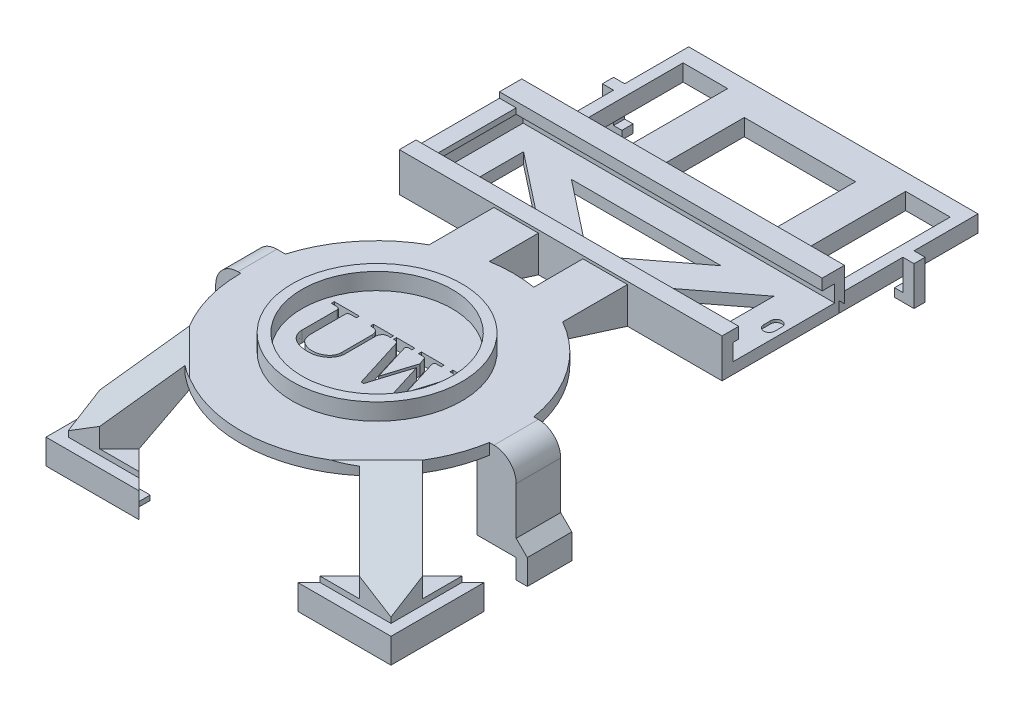
from build123d import *

# Parameters (mm, degrees)
NEOPIXEL_CIRCLE_R                              = 23.5
NEOPIXEL_CIRCLE_R_2                            = 14.5
NEOPIXLE_BASE_DEPTH                            = 2
NEOPIXEL_CIRCLE_R_3                            = 13.5
NEOPIXLE_BASE_2_DEPTH                          = 2
SKETCH2_5_R                                    = 24.5
SKETCH2_5_R_2                                  = 23.5
SKETCH2_5_R_3                                  = 14.5
SKETCH2_5_R_4                                  = 13.5
NEOPIXEL_WALLS_DEPTH                           = 5
BOTTOM_2_SUPPORTS_DEPTH                        = 13.5
BOTTOM_2_SUPPORTS_2_DEPTH                      = 13.5
REMOVING_START                                 = 2
NEOPIXEL_CIRCLE_7_R                            = 24.5
NEOPIXEL_CIRCLE_7_R_2                          = 23.5
REMOVING_NEOPIXEL_OUTER_WALL_DEPTH             = 5
LEVELING_BOTOM_SUPPORTS_DEPTH                  = 2
BOTTOM_RIGHT_SUPPORT_CUT_1_DEPTH               = 48.02629633
BOTTOM_RIGHT_SUPPORT_CUT_1_DEPTH_BACK          = 48.02629633
BOTOM_LEFT_SUPPORT_CUT_1_DEPTH                 = 48.02629633
BOTOM_LEFT_SUPPORT_CUT_1_DEPTH_BACK            = 48.02629633
BOTTOM_SUPPORTS_SMALL_CUTS_DEPTH               = 13.5
MICROBIT_AND_CASE_SUPPORTS_10_W                = 8.093983266
MICROBIT_AND_CASE_SUPPORTS_10_H                = 7
MICROBIT_AND_CASE_SUPPORTS_10_W_2              = 7
MICROBIT_AND_CASE_SUPPORTS_10_H_2              = 8
SIDE_SUPPORTS_1_DEPTH                          = 13.5
MICROBIT_AND_CASE_SUPPORTS_11_W                = 8.093983266
MICROBIT_AND_CASE_SUPPORTS_11_H                = 7
MICROBIT_AND_CASE_SUPPORTS_11_W_2              = 7
MICROBIT_AND_CASE_SUPPORTS_11_H_2              = 8
SIDE_SUPPORTS_2_DEPTH                          = 2
MICROBIT_AND_CASE_SUPPORTS_12_W                = 8
MICROBIT_AND_CASE_SUPPORTS_12_H                = 14.279211733
TOP_SUPPORTS_1_DEPTH                           = 2
MICROBIT_AND_CASE_SUPPORTS_13_W                = 8
MICROBIT_AND_CASE_SUPPORTS_13_H                = 14.279211733
SOMETHING_WITH_TOP_SUPPORTS_DEPTH              = 4.5
NAME_START                                     = -2.5
MICROBIT_AND_CASE_SUPPORTS_14_W                = 58
MICROBIT_AND_CASE_SUPPORTS_14_H                = 21
NAME_PLATE_BACK_DEPTH                          = 2
TOP_START                                      = -4.5
MICROBIT_AND_CASE_SUPPORTS_15_W                = 52
MICROBIT_AND_CASE_SUPPORTS_15_H                = 34
TOP_GANE_PLATE_DEPTH                           = 3
TOP_PLATE_CONNECTOR_W                          = 52
TOP_PLATE_CONNECTOR_H                          = 2
TOP_PLATE_CONNECTOR_PIECE_1_DEPTH              = 2
TOP_PLATE_CONNECTOR_PIECE_2_DEPTH              = 105.648220243
TOP_PLATE_CONNECTOR_PIECE_2_DEPTH_BACK         = 105.648220243
TOP_PLATE_HOLES_W                              = 20
TOP_PLATE_HOLES_H                              = 20
TOP_PLATE_HOLES_W_2                            = 7
TOP_PLATE_HOLES_H_2                            = 17
TOP_PLATE_CUTS_DEPTH                           = 94.141022112
OVERHANG_START                                 = -12.5
MICROBIT_AND_CASE_SUPPORTS_18_W                = 2
MICROBIT_AND_CASE_SUPPORTS_18_H                = 7
MICROBIT_AND_CASE_SUPPORTS_18_H_2              = 8
OVERHANG_ON_SUPPORTS_DEPTH                     = 4.5
BACK_SUPPORTS_W                                = 12.727922061
BACK_SUPPORTS_H                                = 1.85
BACK_SUPPORTS_PIECE_DEPTH                      = 2.5
CIRCLE_CUT_FOR_BACK_PLATE_DEPTH                = 4
MID_RIGHT_SUPPORT_EXTRA_1_DEPTH                = 8
MID_LEFT_SUPPORT_EXTRA_1_1_DEPTH               = 7
NAME_TAG_EXTRUSION_DEPTH                       = 4
NAME_PLATE_DETAILS_W                           = 17
NAME_PLATE_DETAILS_H                           = 2
NAME_PLATE_DETAILS_1_1_DEPTH                   = 56
SIDE_SUPPPORTS_DETAILS_R                       = 4
NAME_TAG_HOLDER_R                              = 1
NAMETAG_HOLDER_DEPTH                           = 0.5
DECORATIONS_DEPTH                              = 95.420601566
TOP_SUPPORTS_CT_1_DEPTH                        = 100.408249155
TOP_SUPPORTS_CT_1_DEPTH_BACK                   = 100.408249155
TOP_CUT_AWAY_FOR_BACK_PLATE_W                  = 52
TOP_CUT_AWAY_FOR_BACK_PLATE_H                  = 7
REMOVING_TOP_PART_DEPTH                        = 10
MK2_FIX_BOTTOM_UNDER_SUPPORTS_W                = 12.727922061
MK2_FIX_BOTTOM_UNDER_SUPPORTS_H                = 1
WIDENING_THE_HOLE_FOR_THE_MOTOBIT_TO_SIT_DEPTH = 2
TOP_PLATE_FIXES_DEPTH                          = 88.625624106
MK_2_NAMETAG_AJUSTMENTS_W                      = 17
MK_2_NAMETAG_AJUSTMENTS_H                      = 1
NAME_PLATE_FIXES_DEPTH                         = 56
MK_2_NAMETAG_AJUSTMENTS_3_W                    = 3
MK_2_NAMETAG_AJUSTMENTS_3_H                    = 1
NAME_PLATE_WIDTH_FIX_DEPTH                     = 58
NAME_TAG_ADJUSTMENTS_PT2_W                     = 1.25
NAME_TAG_ADJUSTMENTS_PT2_H                     = 3
NAME_PLATE_FIXES_PT_2_DEPTH                    = 56
NAME_PLATE_THICCNESS_DEPTH                     = 58
USELESS_DEPTH                                  = 0.5
NAMETAG_HOLDY_HOLE_DEPTH                       = 0.5
ADDING_1_5MM_TO_NAMETAG_AND_TOP_PLATE_CO_W     = 1.5
ADDING_1_5MM_TO_NAMETAG_AND_TOP_PLATE_CO_H     = 3
ADDING_CLEARENCE_TO_TOP_PLATE_AND_NAMEPL_DEPTH = 101.493780902
RE_ENFRCING_TOP_PLATE_DEPTH                    = 52
CUTTING_TOP_PLATE_HOLE_W                       = 20
CUTTING_TOP_PLATE_HOLE_H                       = 1.801941962
ACTUAL_TOP_PLATE_HOLE_CUT_DEPTH                = 88.625624106
HOLES_START                                    = -12.5
HOLES_FORTHE_BACK_SUPPORT_BANGERS_R            = 2
HOLES_FOR_BACK_BANGERS_DEPTH                   = 3
NEOPIXEL_MORE_SUPPORT_R                        = 15.25
NEOPIXEL_MORE_SUPPORT_R_2                      = 14.5
NEOPIXEL_RING_EXTRA_THICC_DEPTH                = 3
TRIMMMING_BOTTOM_EFT_SUPPORT_W                 = 3.804353491
TRIMMMING_BOTTOM_EFT_SUPPORT_H                 = 2
CUT_EXTRUDE9_DEPTH                             = 89.786260198
UW_CUT_DEPTH                                   = 5
SKETCH5_W                                      = 52
SKETCH5_H                                      = 1
EXTEND_TOP_PLATE_DEPTH                         = 3
SKETCH6_W                                      = 2
SKETCH6_H                                      = 2
BOSS_EXTRUDE1_DEPTH                            = 7
SKETCH7_W                                      = 2
SKETCH7_H                                      = 1.5
BOSS_EXTRUDE2_DEPTH                            = 1.5
SKETCH8_W                                      = 2
SKETCH8_H                                      = 1.5
BOSS_EXTRUDE3_DEPTH                            = 1.5
UNDER_NEOPIXWL_R                               = 22
CUT_EXTRUDE10_DEPTH                            = 90.297256397


with BuildPart() as part:
    # neopixel circle → neopixle base (new body)
    with BuildSketch(Plane(origin=(0, 0, 0), x_dir=(1, 0, 0), z_dir=(0, 1, 0))):
        Circle(NEOPIXEL_CIRCLE_R)
        Circle(NEOPIXEL_CIRCLE_R_2, mode=Mode.SUBTRACT)
    extrude(amount=NEOPIXLE_BASE_DEPTH)



with BuildPart() as body_2:
    # neopixel circle → neopixle base 2 (new body)
    with BuildSketch(Plane(origin=(0, 0, 0), x_dir=(1, 0, 0), z_dir=(0, 1, 0))):
        Circle(NEOPIXEL_CIRCLE_R_3)
    extrude(amount=NEOPIXLE_BASE_2_DEPTH)


with BuildPart() as part_1:
    add(part.part)

    add(body_2.part)  # neopixel walls merges body 2
    # Sketch2<5> → neopixel walls (add)
    # profile 1 of 2: a face of its own
    with BuildSketch(Plane(origin=(0, 0, 0), x_dir=(1, 0, 0), z_dir=(0, 1, 0))):
        Circle(SKETCH2_5_R)
        Circle(SKETCH2_5_R_2, mode=Mode.SUBTRACT)
    # profile 2 of 2: a face of its own
    with BuildSketch(Plane(origin=(0, 0, 0), x_dir=(1, 0, 0), z_dir=(0, 1, 0))):
        Circle(SKETCH2_5_R_3)
        Circle(SKETCH2_5_R_4, mode=Mode.SUBTRACT)
    extrude(amount=NEOPIXEL_WALLS_DEPTH)

    # neopixel circle<7> → removing neopixel outer wall (cut)
    with BuildSketch(Plane(origin=(0, 0, 0), x_dir=(1, 0, 0), z_dir=(0, 1, 0)).offset(REMOVING_START)):
        Circle(NEOPIXEL_CIRCLE_7_R)
        Circle(NEOPIXEL_CIRCLE_7_R_2, mode=Mode.SUBTRACT)
    extrude(amount=REMOVING_NEOPIXEL_OUTER_WALL_DEPTH, mode=Mode.SUBTRACT)



with BuildPart() as body_2_2:
    # microbit and case supports → bottom 2 supports (new body)
    with BuildSketch(Plane(origin=(0, 0, 0), x_dir=(1, 0, 0), z_dir=(0, 1, 0))):
        Polygon((-14.150757595, -17.307611845), (-19.807611845, -11.650757595), (-25.464466094, -17.307611845), (-29, -13.772077939), (-29, -26.5), (-16.272077939, -26.5), (-19.807611845, -22.964466094), align=None)
    extrude(amount=-BOTTOM_2_SUPPORTS_DEPTH)


with BuildPart() as body_3:
    # microbit and case supports → bottom 2 supports 2 (new body)
    with BuildSketch(Plane(origin=(0, 0, 0), x_dir=(1, 0, 0), z_dir=(0, 1, 0))):
        Polygon((19.807611845, -22.964466094), (16.272077939, -26.5), (29, -26.5), (29, -13.772077939), (25.464466094, -17.307611845), (19.807611845, -11.650757595), (14.150757595, -17.307611845), align=None)
    extrude(amount=-BOTTOM_2_SUPPORTS_2_DEPTH)


with BuildPart() as part_2:
    add(part_1.part)

    add(body_2_2.part)  # leveling botom supports merges body 2 2

    add(body_3.part)  # leveling botom supports merges body 3
    # microbit and case supports<9> → leveling botom supports (add)
    with BuildSketch(Plane(origin=(0, 0, 0), x_dir=(1, 0, 0), z_dir=(0, 1, 0))):
        with BuildLine():
            Line((-19.807611845, -22.964466094), (-15.673632689, -18.830486938))
            ThreePointArc((-15.673632689, -18.830486938), (-18.544809773, -16.010622427), (-20.915630936, -12.758776687))
            Line((-20.915630936, -12.758776687), (-25.464466094, -17.307611845))
            Line((-25.464466094, -17.307611845), (-29, -13.772077939))
            Line((-29, -13.772077939), (-29, -26.5))
            Line((-29, -26.5), (-16.272077939, -26.5))
            Line((-16.272077939, -26.5), (-19.807611845, -22.964466094))
        make_face()
        with BuildLine():
            Line((15.673632689, -18.830486938), (19.807611845, -22.964466094))
            Line((19.807611845, -22.964466094), (16.272077939, -26.5))
            Line((16.272077939, -26.5), (29, -26.5))
            Line((29, -26.5), (29, -13.772077939))
            Line((29, -13.772077939), (25.464466094, -17.307611845))
            Line((25.464466094, -17.307611845), (20.915630936, -12.758776687))
            ThreePointArc((20.915630936, -12.758776687), (18.544809773, -16.010622427), (15.673632689, -18.830486938))
        make_face()
    extrude(amount=LEVELING_BOTOM_SUPPORTS_DEPTH)

    # bottom right support → bottom right support cut 1 (cut, two sides: drawn at the far end of the back side and taken through both)
    with BuildSketch(Plane(origin=(4.078427125, 0, -4.078427125), x_dir=(-0.7071067811865475, 0, -0.7071067811865477), z_dir=(0.7071067811865477, 0, -0.7071067811865475)).offset(-BOTTOM_RIGHT_SUPPORT_CUT_1_DEPTH_BACK)):
        Polygon((-22.244426356, 0), (-30.244426356, -11.5), (-30.244426356, -13.5), (-22.244426356, -13.5), align=None)
        Polygon((-23.811401983, 2), (-39.244426356, 2), (-39.244426356, -11.5), align=None)
    extrude(amount=BOTTOM_RIGHT_SUPPORT_CUT_1_DEPTH + BOTTOM_RIGHT_SUPPORT_CUT_1_DEPTH_BACK, mode=Mode.SUBTRACT)

    # bottom left support → botom left support cut 1 (cut, two sides: drawn at the far end of the back side and taken through both)
    with BuildSketch(Plane(origin=(-4.078427125, 0, -4.078427125), x_dir=(-0.707106781186546, 0, 0.707106781186549), z_dir=(-0.707106781186549, 0, -0.707106781186546)).offset(-BOTOM_LEFT_SUPPORT_CUT_1_DEPTH_BACK)):
        Polygon((22.244426356, -13.5), (30.244426356, -13.5), (30.244426356, -11.5), (22.244426356, 0), align=None)
        Polygon((23.811401983, 2), (39.244426356, -11.5), (39.244426356, 2), align=None)
    extrude(amount=BOTOM_LEFT_SUPPORT_CUT_1_DEPTH + BOTOM_LEFT_SUPPORT_CUT_1_DEPTH_BACK, mode=Mode.SUBTRACT)

    # bottom supports small cut 2 → bottom supports small cuts (cut)
    with BuildSketch(Plane(origin=(0, 2, 0), x_dir=(1, 0, 0), z_dir=(0, 1, 0))):
        Polygon((-19.807611845, -22.964466094), (-23.343145751, -26.5), (-16.272077939, -26.5), align=None)
        Polygon((-25.464466094, -17.307611845), (-29, -20.843145751), (-29, -13.772077939), align=None)
        Polygon((19.807611845, -22.964466094), (23.343145751, -26.5), (16.272077939, -26.5), align=None)
        Polygon((25.464466094, -17.307611845), (29, -20.843145751), (29, -13.772077939), align=None)
    extrude(amount=-BOTTOM_SUPPORTS_SMALL_CUTS_DEPTH, mode=Mode.SUBTRACT)

    # microbit and case supports<10> → side supports 1 (add)
    with BuildSketch(Plane(origin=(0, 0, 0), x_dir=(1, 0, 0), z_dir=(0, 1, 0))):
        with Locations((-24.953008367, 3.5)):
            Rectangle(MICROBIT_AND_CASE_SUPPORTS_10_W, MICROBIT_AND_CASE_SUPPORTS_10_H)
        with Locations((25.5, 0)):
            Rectangle(MICROBIT_AND_CASE_SUPPORTS_10_W_2, MICROBIT_AND_CASE_SUPPORTS_10_H_2)
    extrude(amount=-SIDE_SUPPORTS_1_DEPTH)

    # microbit and case supports<11> → side supports 2 (add)
    with BuildSketch(Plane(origin=(0, 0, 0), x_dir=(1, 0, 0), z_dir=(0, 1, 0))):
        with Locations((-24.953008367, 3.5)):
            Rectangle(MICROBIT_AND_CASE_SUPPORTS_11_W, MICROBIT_AND_CASE_SUPPORTS_11_H)
        with Locations((25.5, 0)):
            Rectangle(MICROBIT_AND_CASE_SUPPORTS_11_W_2, MICROBIT_AND_CASE_SUPPORTS_11_H_2)
    extrude(amount=SIDE_SUPPORTS_2_DEPTH)

    # microbit and case supports<12> → top supports 1 (add)
    with BuildSketch(Plane(origin=(0, 0, 0), x_dir=(1, 0, 0), z_dir=(0, 1, 0))):
        with Locations((8, 25.860394134)):
            Rectangle(MICROBIT_AND_CASE_SUPPORTS_12_W, MICROBIT_AND_CASE_SUPPORTS_12_H)
        with Locations((-8, 25.860394134)):
            Rectangle(MICROBIT_AND_CASE_SUPPORTS_12_W, MICROBIT_AND_CASE_SUPPORTS_12_H)
    extrude(amount=TOP_SUPPORTS_1_DEPTH)

    # microbit and case supports<13> → something with top supports (add)
    with BuildSketch(Plane(origin=(0, 0, 0), x_dir=(1, 0, 0), z_dir=(0, 1, 0))):
        with Locations((8, 25.860394134)):
            Rectangle(MICROBIT_AND_CASE_SUPPORTS_13_W, MICROBIT_AND_CASE_SUPPORTS_13_H)
        with Locations((-8, 25.860394134)):
            Rectangle(MICROBIT_AND_CASE_SUPPORTS_13_W, MICROBIT_AND_CASE_SUPPORTS_13_H)
    extrude(amount=-SOMETHING_WITH_TOP_SUPPORTS_DEPTH)

    # microbit and case supports<14> → name plate back (add)
    with BuildSketch(Plane(origin=(0, 0, 0), x_dir=(1, 0, 0), z_dir=(0, 1, 0)).offset(NAME_START)):
        with Locations((0, 43.5)):
            Rectangle(MICROBIT_AND_CASE_SUPPORTS_14_W, MICROBIT_AND_CASE_SUPPORTS_14_H)
    extrude(amount=-NAME_PLATE_BACK_DEPTH)



with BuildPart() as body_2_3:
    # microbit and case supports<15> → top gane plate (new body)
    with BuildSketch(Plane(origin=(0, 0, 0), x_dir=(1, 0, 0), z_dir=(0, 1, 0)).offset(TOP_START)):
        with Locations((0, 71)):
            Rectangle(MICROBIT_AND_CASE_SUPPORTS_15_W, MICROBIT_AND_CASE_SUPPORTS_15_H)
    extrude(amount=-TOP_GANE_PLATE_DEPTH)


with BuildPart() as part_3:
    add(part_2.part)

    add(body_2_3.part)  # top plate connector piece 1 merges body 2 3
    # top plate connector → top plate connector piece 1 (add)
    with BuildSketch(Plane(origin=(0, -4.5, 0), x_dir=(1, 0, 0), z_dir=(0, 1, 0))):
        with Locations((0, 55)):
            Rectangle(TOP_PLATE_CONNECTOR_W, TOP_PLATE_CONNECTOR_H)
    extrude(amount=TOP_PLATE_CONNECTOR_PIECE_1_DEPTH)

    # top plate connector looks → top plate connector piece 2 (cut, two sides: drawn at the far end of the back side and taken through both)
    with BuildSketch(Plane(origin=(26, 0, 0), x_dir=(0, 0, -1), z_dir=(1, 0, 0)).offset(-TOP_PLATE_CONNECTOR_PIECE_2_DEPTH_BACK)):
        Polygon((56, -4.5), (54, -2.5), (56, -2.5), align=None)
    extrude(amount=TOP_PLATE_CONNECTOR_PIECE_2_DEPTH + TOP_PLATE_CONNECTOR_PIECE_2_DEPTH_BACK, mode=Mode.SUBTRACT)

    # top plate holes → top plate cuts (cut, through all)
    with BuildSketch(Plane(origin=(0, -4.5, 0), x_dir=(1, 0, 0), z_dir=(0, 1, 0))):
        with Locations((0, 66)):
            Rectangle(TOP_PLATE_HOLES_W, TOP_PLATE_HOLES_H)
        with Locations((20.5, 70.5)):
            Rectangle(TOP_PLATE_HOLES_W_2, TOP_PLATE_HOLES_H_2)
        with Locations((-20.5, 70.5)):
            Rectangle(TOP_PLATE_HOLES_W_2, TOP_PLATE_HOLES_H_2)
    extrude(amount=-TOP_PLATE_CUTS_DEPTH, mode=Mode.SUBTRACT)

    # microbit and case supports<18> → overhang on supports (add)
    with BuildSketch(Plane(origin=(0, 0, 0), x_dir=(1, 0, 0), z_dir=(0, 1, 0)).offset(OVERHANG_START)):
        with Locations((-30, 3.5)):
            Rectangle(MICROBIT_AND_CASE_SUPPORTS_18_W, MICROBIT_AND_CASE_SUPPORTS_18_H)
        with Locations((30, 0)):
            Rectangle(MICROBIT_AND_CASE_SUPPORTS_18_W, MICROBIT_AND_CASE_SUPPORTS_18_H_2)
        Polygon((-14.272077939, -28.5), (-16.272077939, -26.5), (-29, -26.5), (-29, -13.772077939), (-31, -11.772077939), (-31, -28.5), align=None)
        Polygon((29, -26.5), (16.272077939, -26.5), (14.272077939, -28.5), (31, -28.5), (31, -11.772077939), (29, -13.772077939), align=None)
    extrude(amount=-OVERHANG_ON_SUPPORTS_DEPTH)

    # back supports → back supports piece (add)
    with BuildSketch(Plane(origin=(0, 0, 26.5), x_dir=(-1, 0, 0), z_dir=(0, 0, -1))):
        with Locations((-22.63603897, -16.075)):
            Rectangle(BACK_SUPPORTS_W, BACK_SUPPORTS_H)
        with Locations((22.63603897, -16.075)):
            Rectangle(BACK_SUPPORTS_W, BACK_SUPPORTS_H)
    extrude(amount=BACK_SUPPORTS_PIECE_DEPTH)

    # holes for back piece → circle cut for back plate (cut)
    with BuildSketch(Plane.XZ.offset(17)):
        with BuildLine():
            Line((29, 24.5), (16.272077939, 24.5))
            Line((16.272077939, 24.5), (16.272077939, 24))
            Line((16.272077939, 24), (20.677124344, 24))
            ThreePointArc((20.677124344, 24), (22, 20.5), (23.322875656, 24))
            Line((23.322875656, 24), (29, 24))
            Line((29, 24), (29, 24.5))
        make_face()
        with BuildLine():
            Line((-16.272077939, 24.5), (-21.675121015, 24.5))
            Line((-21.675121015, 24.5), (-21.675121015, 24.473437013))
            ThreePointArc((-21.675121015, 24.473437013), (-21.837018446, 24.493348192), (-22, 24.5))
            Line((-22, 24.5), (-29, 24.5))
            Line((-29, 24.5), (-29, 24))
            Line((-29, 24), (-23.322875656, 24))
            ThreePointArc((-23.322875656, 24), (-23.822875656, 23.322875656), (-24, 22.5))
            ThreePointArc((-24, 22.5), (-21.177124344, 20.677124344), (-20.677124344, 24))
            Line((-20.677124344, 24), (-16.272077939, 24))
            Line((-16.272077939, 24), (-16.272077939, 24.5))
        make_face()
    extrude(amount=-CIRCLE_CUT_FOR_BACK_PLATE_DEPTH, mode=Mode.SUBTRACT)

    # mid right support extra → mid right support extra 1 (add)
    with BuildSketch(Plane(origin=(0, 0, -4), x_dir=(-1, 0, 0), z_dir=(0, 0, -1))):
        Polygon((-31, -12.5), (-29, -10.5), (-29, -12.5), align=None)
    extrude(amount=-MID_RIGHT_SUPPORT_EXTRA_1_DEPTH)

    # mid left support extra 1 → mid left support extra 1.1 (add)
    with BuildSketch(Plane(origin=(0, 0, -7), x_dir=(-1, 0, 0), z_dir=(0, 0, -1))):
        Polygon((29, -12.5), (31, -12.5), (29, -10.5), align=None)
    extrude(amount=-MID_LEFT_SUPPORT_EXTRA_1_1_DEPTH)

    # name tag extrusion 1.1 → name tag extrusion (add)
    with BuildSketch(Plane(origin=(0, -2.5, 0), x_dir=(1, 0, 0), z_dir=(0, 1, 0))):
        Polygon((29, 33), (29, 36), (-26, 36), (-26, 51), (29, 51), (29, 54), (-29, 54), (-29, 33), align=None)
    extrude(amount=NAME_TAG_EXTRUSION_DEPTH)

    # name plate details → name plate details 1.1 (cut)
    with BuildSketch(Plane(origin=(29, 0, 0), x_dir=(0, 0, -1), z_dir=(1, 0, 0))):
        with Locations((43.5, -1.5)):
            Rectangle(NAME_PLATE_DETAILS_W, NAME_PLATE_DETAILS_H)
    extrude(amount=-NAME_PLATE_DETAILS_1_1_DEPTH, mode=Mode.SUBTRACT)

    # side suppports details
    side_suppports_details_edges = [part_3.edges().sort_by_distance(p)[0] for p in [
        (29, 2, 0),
        (-29, 2, -3.5),
    ]]
    fillet(side_suppports_details_edges, radius=SIDE_SUPPPORTS_DETAILS_R)

    # name tag holder → nametag holder (cut)
    with BuildSketch(Plane(origin=(0, -2.5, 0), x_dir=(1, 0, 0), z_dir=(0, 1, 0))):
        with Locations((27, 43.5)):
            Circle(NAME_TAG_HOLDER_R)
    extrude(amount=-NAMETAG_HOLDER_DEPTH, mode=Mode.SUBTRACT)

    # name tag holder<3> → decorations (cut, through all)
    with BuildSketch(Plane(origin=(0, -2.5, 0), x_dir=(1, 0, 0), z_dir=(0, 1, 0))):
        Polygon((-9.230797234, 38.40110616), (-22.519977371, 48.842604839), (-22.519977371, 38.40110616), align=None)
        Polygon((-0.624471051, 38.40110616), (12.981118137, 48.842604839), (-13.913651187, 48.842604839), align=None)
        Polygon((22.473389663, 38.40110616), (22.473389663, 48.842604839), (8.867800475, 38.40110616), align=None)
    extrude(amount=-DECORATIONS_DEPTH, mode=Mode.SUBTRACT)

    # top support details → top supports ct 1 (cut, two sides: drawn at the far end of the back side and taken through both)
    with BuildSketch(Plane.ZY.offset(12).offset(-TOP_SUPPORTS_CT_1_DEPTH_BACK)):
        Polygon((-33, -4.5), (-18.720788267, 0), (-18.720788267, -4.5), align=None)
    extrude(amount=TOP_SUPPORTS_CT_1_DEPTH + TOP_SUPPORTS_CT_1_DEPTH_BACK, mode=Mode.SUBTRACT)

    # top cut away for back plate → removing top part (cut)
    with BuildSketch(Plane(origin=(0, -4.5, 0), x_dir=(1, 0, 0), z_dir=(0, 1, 0))):
        with Locations((0, 84.5)):
            Rectangle(TOP_CUT_AWAY_FOR_BACK_PLATE_W, TOP_CUT_AWAY_FOR_BACK_PLATE_H)
    extrude(amount=-REMOVING_TOP_PART_DEPTH, mode=Mode.SUBTRACT)

    # mk2- fix bottom under supports → widening the hole for the motobit to sit (cut)
    with BuildSketch(Plane(origin=(0, 0, 24.5), x_dir=(-1, 0, 0), z_dir=(0, 0, -1))):
        with Locations((-22.63603897, -15.65)):
            Rectangle(MK2_FIX_BOTTOM_UNDER_SUPPORTS_W, MK2_FIX_BOTTOM_UNDER_SUPPORTS_H)
        with Locations((22.63603897, -15.65)):
            Rectangle(MK2_FIX_BOTTOM_UNDER_SUPPORTS_W, MK2_FIX_BOTTOM_UNDER_SUPPORTS_H)
    extrude(amount=-WIDENING_THE_HOLE_FOR_THE_MOTOBIT_TO_SIT_DEPTH, mode=Mode.SUBTRACT)

    # Mk-2 top holes fixing → top plate fixes (cut, through all)
    with BuildSketch(Plane(origin=(0, -4.5, 0), x_dir=(1, 0, 0), z_dir=(0, 1, 0))):
        Polygon((-16, 79), (-17, 79), (-17, 62), (-24, 62), (-24, 60), (-16, 60), align=None)
        Polygon((17, 62), (17, 79), (16, 79), (16, 60), (24, 60), (24, 62), align=None)
    extrude(amount=-TOP_PLATE_FIXES_DEPTH, mode=Mode.SUBTRACT)

    # Mk-2 nametag ajustments → name plate fixes (cut)
    with BuildSketch(Plane(origin=(29, 0, 0), x_dir=(0, 0, -1), z_dir=(1, 0, 0))):
        with Locations((43.5, 0)):
            Rectangle(MK_2_NAMETAG_AJUSTMENTS_W, MK_2_NAMETAG_AJUSTMENTS_H)
    extrude(amount=-NAME_PLATE_FIXES_DEPTH, mode=Mode.SUBTRACT)

    # Mk-2 nametag ajustments<3> → name plate width fix (add)
    with BuildSketch(Plane(origin=(29, 0, 0), x_dir=(0, 0, -1), z_dir=(1, 0, 0))):
        with Locations((34.5, 2)):
            Rectangle(MK_2_NAMETAG_AJUSTMENTS_3_W, MK_2_NAMETAG_AJUSTMENTS_3_H)
        with Locations((52.5, 2)):
            Rectangle(MK_2_NAMETAG_AJUSTMENTS_3_W, MK_2_NAMETAG_AJUSTMENTS_3_H)
    extrude(amount=-NAME_PLATE_WIDTH_FIX_DEPTH)

    # name tag adjustments pt2 → name plate fixes pt 2 (cut)
    with BuildSketch(Plane(origin=(29, 0, 0), x_dir=(0, 0, -1), z_dir=(1, 0, 0))):
        with Locations((52.625, -1)):
            Rectangle(NAME_TAG_ADJUSTMENTS_PT2_W, NAME_TAG_ADJUSTMENTS_PT2_H)
    extrude(amount=-NAME_PLATE_FIXES_PT_2_DEPTH, mode=Mode.SUBTRACT)

    # name tag adjustments pt2<3> → name plate thiccness (add)
    with BuildSketch(Plane(origin=(29, 0, 0), x_dir=(0, 0, -1), z_dir=(1, 0, 0))):
        Polygon((55, 2.5), (54, 2.5), (54, -2.5), (55, -3.5), align=None)
    extrude(amount=-NAME_PLATE_THICCNESS_DEPTH)

    # fixing nameplate hole → useless (add)
    with BuildSketch(Plane(origin=(0, -2.5, 0), x_dir=(1, 0, 0), z_dir=(0, 1, 0))):
        with BuildLine():
            ThreePointArc((26, 43.5), (27, 42.5), (28, 43.5))
            Line((28, 43.5), (28, 44.75))
            ThreePointArc((28, 44.75), (27, 45.75), (26, 44.75))
            Line((26, 44.75), (26, 43.5))
        make_face()
    extrude(amount=-USELESS_DEPTH)

    # fixing nameplate hole<3> → nametag holdy hole (cut)
    with BuildSketch(Plane(origin=(0, -2.5, 0), x_dir=(1, 0, 0), z_dir=(0, 1, 0))):
        with BuildLine():
            ThreePointArc((26, 43.5), (27, 42.5), (28, 43.5))
            Line((28, 43.5), (28, 44.75))
            ThreePointArc((28, 44.75), (27, 45.75), (26, 44.75))
            Line((26, 44.75), (26, 43.5))
        make_face()
    extrude(amount=-NAMETAG_HOLDY_HOLE_DEPTH, mode=Mode.SUBTRACT)

    # adding 1.5mm to nametag and top plate co → adding clearence to top plate and namepl (cut, through all)
    with BuildSketch(Plane(origin=(26, 0, 0), x_dir=(0, 0, -1), z_dir=(1, 0, 0))):
        with Locations((54.75, -6)):
            Rectangle(ADDING_1_5MM_TO_NAMETAG_AND_TOP_PLATE_CO_W, ADDING_1_5MM_TO_NAMETAG_AND_TOP_PLATE_CO_H)
    extrude(amount=-ADDING_CLEARENCE_TO_TOP_PLATE_AND_NAMEPL_DEPTH, mode=Mode.SUBTRACT)

    # adding 1.5mm to nametag and top plat 2 → re-enfrcing top plate (add)
    with BuildSketch(Plane(origin=(26, 0, 0), x_dir=(0, 0, -1), z_dir=(1, 0, 0))):
        Polygon((55, -3.5), (56, -4.5), (57, -4.5), (57, -3), (55.5, -3), (54.5, -3), align=None)
    extrude(amount=-RE_ENFRCING_TOP_PLATE_DEPTH)

    # cutting top plate hole → actual top plate hole cut (cut, through all)
    with BuildSketch(Plane.XZ.offset(7.5)):
        with Locations((0, -56.900970981)):
            Rectangle(CUTTING_TOP_PLATE_HOLE_W, CUTTING_TOP_PLATE_HOLE_H)
    extrude(amount=-ACTUAL_TOP_PLATE_HOLE_CUT_DEPTH, mode=Mode.SUBTRACT)

    # holes forthe back support bangers → holes for back bangers (cut)
    with BuildSketch(Plane(origin=(0, 2, 0), x_dir=(1, 0, 0), z_dir=(0, 1, 0)).offset(HOLES_START)):
        with Locations((-20, -20.5)):
            Circle(HOLES_FORTHE_BACK_SUPPORT_BANGERS_R)
        with Locations((20, -20.5)):
            Circle(HOLES_FORTHE_BACK_SUPPORT_BANGERS_R)
    extrude(amount=-HOLES_FOR_BACK_BANGERS_DEPTH, mode=Mode.SUBTRACT)

    # neopixel more support → neopixel ring extra thicc (add)
    with BuildSketch(Plane(origin=(0, 2, 0), x_dir=(1, 0, 0), z_dir=(0, 1, 0))):
        Circle(NEOPIXEL_MORE_SUPPORT_R)
        Circle(NEOPIXEL_MORE_SUPPORT_R_2, mode=Mode.SUBTRACT)
    extrude(amount=NEOPIXEL_RING_EXTRA_THICC_DEPTH)

    # trimmming bottom eft support → Cut-Extrude9 (cut, through all)
    with BuildSketch(Plane(origin=(0, 2, 0), x_dir=(1, 0, 0), z_dir=(0, 1, 0))):
        with Locations((-29.097823255, -12.772077939)):
            Rectangle(TRIMMMING_BOTTOM_EFT_SUPPORT_W, TRIMMMING_BOTTOM_EFT_SUPPORT_H)
    extrude(amount=-CUT_EXTRUDE9_DEPTH, mode=Mode.SUBTRACT)

    # Sketch4 → UW cut (cut)
    with BuildSketch(Plane(origin=(0, 2, 0), x_dir=(1, 0, 0), z_dir=(0, 1, 0))):
        with BuildLine():
            Line((-11.682559544, 3.987330857), (-7.180157542, 3.987330857))
            Line((-7.180157542, 3.987330857), (-7.180157542, 3.460896161))
            Line((-7.180157542, 3.460896161), (-8.285519155, 3.460896161))
            add(Edge.make_bspline(
                [(-8.285519155, 3.460896161), (-8.787328329, 3.341988901), (-8.740252606, 2.964158965)],
                knots=[0, 0, 0, 1, 1, 1], degree=2))
            Line((-8.740252606, 2.964158965), (-8.740252606, -3.305849773))
            add(Edge.make_bspline(
                [(-8.740252606, -3.305849773), (-8.680697512, -3.720128985), (-8.59088809, -4.463809665), (-7.779227327, -5.231220337), (-6.555316883, -5.741099315), (-4.422316743, -5.622054075), (-3.043851296, -4.315189428), (-3.111537793, -3.226245765)],
                knots=[0, 0, 0, 0, 0.159722522, 0.252853396, 0.396576245, 0.636972652, 1, 1, 1, 1], degree=3))
            Line((-3.111537793, -3.226245765), (-3.111537793, 2.277475315))
            add(Edge.make_bspline(
                [(-3.111537793, 2.277475315), (-3.10399174, 2.820972491), (-3.514751891, 3.419282768), (-4.085697446, 3.460896161)],
                knots=[0, 0, 0, 0, 1, 1, 1, 1], degree=3))
            Line((-4.085697446, 3.460896161), (-4.644958877, 3.460896161))
            Line((-4.644958877, 3.460896161), (-4.644958877, 3.987330857))
            Line((-4.644958877, 3.987330857), (-1.029183731, 3.987330857))
            Line((-1.029183731, 3.987330857), (-1.029183731, 3.460896161))
            Line((-1.029183731, 3.460896161), (-1.591234591, 3.460896161))
            Line((-1.591234591, 3.460896161), (-1.995365445, 3.349123011))
            add(Edge.make_bspline(
                [(-2.578771874, 2.277475315), (-2.567490474, 2.963648902), (-1.995365445, 3.349123011)],
                knots=[0, 0, 0, 1, 1, 1], degree=2))
            Line((-2.578771874, 2.277475315), (-2.578771874, -3.226245765))
            add(Edge.make_bspline(
                [(-10.159908257, -3.305849773), (-10.177786069, -3.969909116), (-9.518030986, -5.479647024), (-7.00795307, -6.319945489), (-4.045906696, -6.07854764), (-2.59237997, -4.298169584), (-2.578771874, -3.226245765)],
                knots=[0, 0, 0, 0, 0.18840657, 0.430150719, 0.702039093, 1, 1, 1, 1], degree=3))
            Line((-10.159908257, -3.305849773), (-10.159908257, 2.964158965))
            add(Edge.make_bspline(
                [(-10.636823828, 3.460896161), (-10.111942977, 3.351735567), (-10.159908257, 2.964158965)],
                knots=[0, 0, 0, 1, 1, 1], degree=2))
            Line((-10.636823828, 3.460896161), (-11.682559544, 3.460896161))
            Line((-11.682559544, 3.460896161), (-11.682559544, 3.987330857))
        make_face()
        with BuildLine():
            Line((-0.502048658, 3.987330857), (-0.502048658, 3.460896161))
            add(Edge.make_bspline(
                [(-0.502048658, 3.460896161), (0.067790841, 3.535712036), (0.357076753, 3.086160623)],
                knots=[0, 0, 0, 1, 1, 1], degree=2))
            Line((0.357076753, 3.086160623), (3.244839199, -6.113837042))
            Line((3.244839199, -6.113837042), (3.705679516, -6.113837042))
            Line((3.705679516, -6.113837042), (5.979316979, 1.145405727))
            Line((5.979316979, 1.145405727), (8.257901106, -6.113837042))
            Line((8.257901106, -6.113837042), (8.71866891, -6.113837042))
            Line((8.71866891, -6.113837042), (11.270918499, 2.277475315))
            add(Edge.make_bspline(
                [(11.270918499, 2.277475315), (11.525689867, 3.339118462), (12.693654525, 3.460896161)],
                knots=[0, 0, 0, 1, 1, 1], degree=2))
            Line((12.693654525, 3.460896161), (12.693654525, 3.987330857))
            Line((12.693654525, 3.987330857), (9.634361236, 3.987330857))
            Line((9.634361236, 3.987330857), (9.634361236, 3.460896161))
            Line((9.634361236, 3.460896161), (10.106855166, 3.460896161))
            add(Edge.make_bspline(
                [(10.700428962, 2.277475315), (10.764190052, 2.708981366), (10.744297195, 3.489364478), (10.106855166, 3.460896161)],
                knots=[0, 0, 0, 0, 1, 1, 1, 1], degree=3))
            Line((10.700428962, 2.277475315), (8.902151108, -3.634921044))
            Line((8.902151108, -3.634921044), (6.823589409, 3.086160623))
            add(Edge.make_bspline(
                [(7.272375277, 3.460896161), (6.875968847, 3.499121629), (6.823589409, 3.086160623)],
                knots=[0, 0, 0, 1, 1, 1], degree=2))
            Line((7.272375277, 3.460896161), (8.073544605, 3.460896161))
            Line((8.073544605, 3.460896161), (8.073544605, 3.987330857))
            Line((8.073544605, 3.987330857), (3.967154754, 3.987330857))
            Line((3.967154754, 3.987330857), (3.967154754, 3.460896161))
            Line((3.967154754, 3.460896161), (4.842498247, 3.460896161))
            add(Edge.make_bspline(
                [(5.303473633, 3.086160623), (5.2233356, 3.428243633), (4.842498247, 3.460896161)],
                knots=[0, 0, 0, 1, 1, 1], degree=2))
            Line((5.303473633, 3.086160623), (5.690911201, 2.038047508))
            Line((5.690911201, 2.038047508), (3.911555817, -3.634921044))
            Line((3.911555817, -3.634921044), (1.832994118, 3.086160623))
            add(Edge.make_bspline(
                [(2.211481039, 3.460896161), (1.833247522, 3.487695205), (1.832994118, 3.086160623)],
                knots=[0, 0, 0, 1, 1, 1], degree=2))
            Line((2.211481039, 3.460896161), (2.796256443, 3.460896161))
            Line((2.796256443, 3.460896161), (2.796256443, 3.987330857))
            Line((2.796256443, 3.987330857), (-0.502048658, 3.987330857))
        make_face()
    extrude(amount=-UW_CUT_DEPTH, mode=Mode.SUBTRACT)

    # Sketch5 → extend top plate (add)
    with BuildSketch(Plane(origin=(0, -4.5, 0), x_dir=(1, 0, 0), z_dir=(0, 1, 0))):
        with Locations((0, 81.5)):
            Rectangle(SKETCH5_W, SKETCH5_H)
    extrude(amount=-EXTEND_TOP_PLATE_DEPTH)

    # Sketch6 → Boss-Extrude1 (add)
    with BuildSketch(Plane(origin=(0, -4.5, 0), x_dir=(1, 0, 0), z_dir=(0, 1, 0))):
        with Locations((-27, 69.5)):
            Rectangle(SKETCH6_W, SKETCH6_H)
        with Locations((27, 69.5)):
            Rectangle(SKETCH6_W, SKETCH6_H)
    extrude(amount=-BOSS_EXTRUDE1_DEPTH)

    # Sketch7 → Boss-Extrude2 (add)
    with BuildSketch(Plane(origin=(-26, 0, 0), x_dir=(0, 0, -1), z_dir=(1, 0, 0))):
        with Locations((69.5, -10.75)):
            Rectangle(SKETCH7_W, SKETCH7_H)
    extrude(amount=BOSS_EXTRUDE2_DEPTH)

    # Sketch8 → Boss-Extrude3 (add)
    with BuildSketch(Plane.ZY.offset(-26)):
        with Locations((-69.5, -10.75)):
            Rectangle(SKETCH8_W, SKETCH8_H)
    extrude(amount=BOSS_EXTRUDE3_DEPTH)

    # under neopixwl → Cut-Extrude10 (cut, through all)
    with BuildSketch(Plane.XZ):
        Circle(UNDER_NEOPIXWL_R)
    extrude(amount=CUT_EXTRUDE10_DEPTH, mode=Mode.SUBTRACT)


solid = part_3.part
